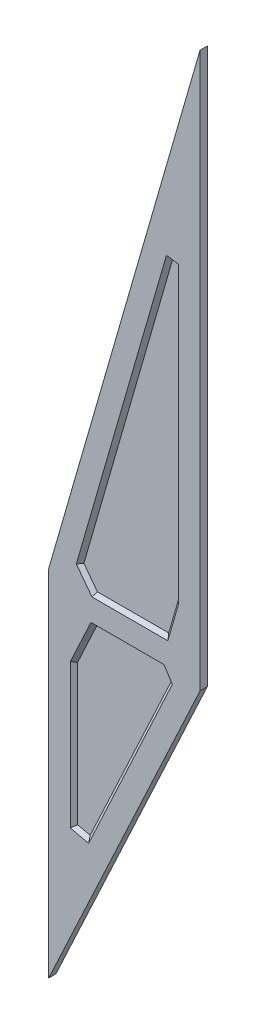
from build123d import *

# Parameters (mm, degrees)
BOSS_EXTRU_1_DEPTH      = 10
ENL_V_MAT_EXTRU_1_DEPTH = 5
CHANFREIN1_SIZE         = 5


with BuildPart() as part:
    # Esquisse1 → Boss.-Extru.1 (new body)
    with BuildSketch(Plane.XY):
        Polygon((0, 0), (0, -450), (210, 0), (210, 727.857142857), (210, 769.998850412), (0, 42.141707555), align=None)
    extrude(amount=BOSS_EXTRU_1_DEPTH)

    # Esquisse2 → Enlèv. mat.-Extru.1 (cut)
    with BuildSketch(Plane.XY.offset(10)):
        Polygon((60, 37.900434867), (165.302631408, 37.900434867), (180, 88.841314442), (180, 497.798394051), (163.367347804, 500.149847834), (38.316326098, 66.724707975), align=None)
        Polygon((58.611734047, 6.655480102), (30, -54.655378569), (30, -254.773091326), (55.37312792, -260.402102926), (171.542290693, -11.468182697), (160, 6.655480102), align=None)
    extrude(amount=-ENL_V_MAT_EXTRU_1_DEPTH, mode=Mode.SUBTRACT)

    # Chanfrein1
    chanfrein1_edges = [part.edges().sort_by_distance(p)[0] for p in [
        (165.771145347, -2.406351297, 5),
        (113.457709307, -135.935142812, 5),
        (42.68656396, -257.587597126, 5),
        (30, -154.714234948, 5),
        (44.305867023, -23.999949233, 5),
        (109.305867023, 6.655480102, 5),
        (171.683673902, 498.974120942, 5),
        (180, 293.319854246, 5),
        (172.651315704, 63.370874655, 5),
        (112.651315704, 37.900434867, 5),
        (49.158163049, 52.312571421, 5),
        (100.841836951, 283.437277905, 5),
    ]]
    chamfer(chanfrein1_edges, length=CHANFREIN1_SIZE - 0.0001)  # a hair under: the kernel refuses the full size


solid = part.part
